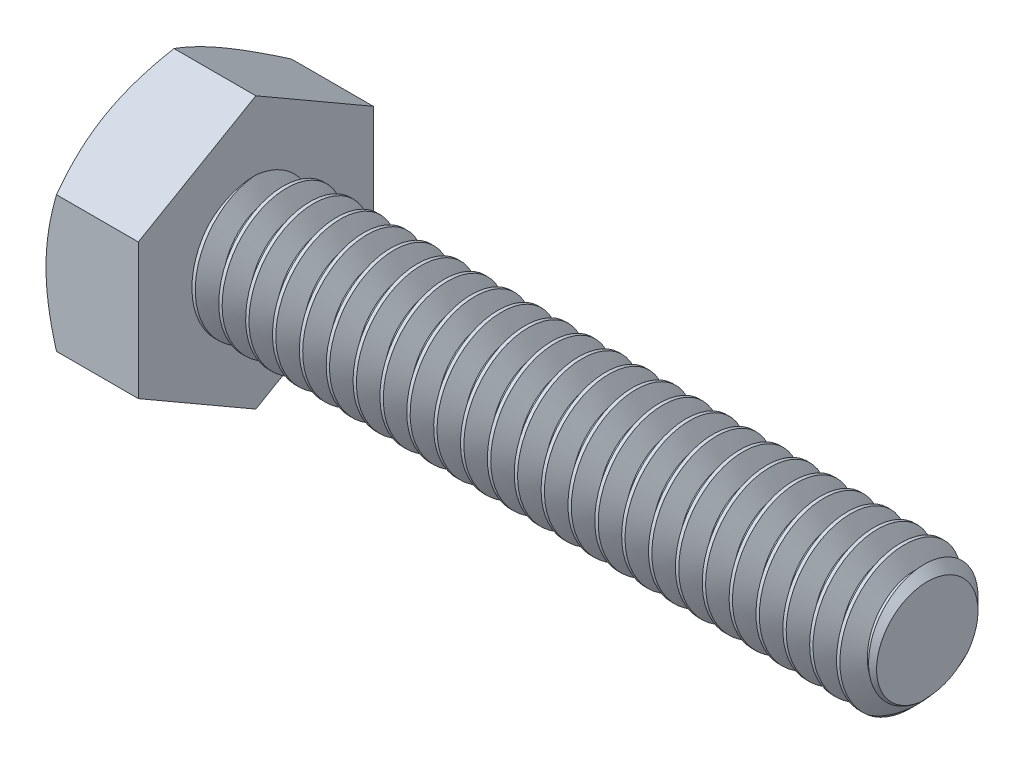
from build123d import *

# Parameters (mm, degrees)
SKETCH5_R           = 3.175
BOSS_EXTRUDE3_DEPTH = 31.75
CHAMFER1_SIZE       = 0.77724
CUT_SWEEP1_PITCH    = 1.27
BOSS_EXTRUDE4_DEPTH = 4.365625
SKETCH8_OUTSIDE_W   = 153.074
SKETCH8_OUTSIDE_H   = 154.794
SKETCH8_OUTSIDE_R   = 5.55625
CUT_EXTRUDE3_DEPTH  = 38.099499254
CUT_EXTRUDE3_DRAFT  = -60
CUT_EXTRUDE4_DEPTH  = 0.254
CIRPATTERN1_COUNT   = 3


with BuildPart() as part:
    # Sketch5 → Boss-Extrude3 (new body)
    with BuildSketch(Plane(origin=(18.0578125, 0, 0), x_dir=(0, 0, -1), z_dir=(1, 0, 0))):
        Circle(SKETCH5_R)
    extrude(amount=-BOSS_EXTRUDE3_DEPTH)

    # Chamfer1
    chamfer1_edges = [part.edges().sort_by_distance(p)[0] for p in [
        (18.0578125, 0, 3.175),
    ]]
    chamfer(chamfer1_edges, length=CHAMFER1_SIZE)

    # Cut-Sweep1: arcs per turn and ends read off the stored shape
    # Cut-Sweep1: the profile of Sketch10 profile screwed along a right-hand helix through 26 turns, 8 arcs to a turn; built about Z, then put on its axis
    cut_sweep1_z = Axis((0, 0, 0), (0, 0, 1))
    cut_sweep1_corners = [(3.1753, 0, 0.000173205), (2.350110803, 0, -0.47625), (2.350110803, 0, -0.635), (3.1753, 0, -1.111423205)]
    with BuildLine(mode=Mode.PRIVATE) as cut_sweep1_profile:
        Line(cut_sweep1_corners[0], cut_sweep1_corners[1])
        Line(cut_sweep1_corners[1], cut_sweep1_corners[2])
        Line(cut_sweep1_corners[2], cut_sweep1_corners[3])
        Line(cut_sweep1_corners[3], cut_sweep1_corners[0])
    cut_sweep1_cap = Face(cut_sweep1_profile.wire())
    cut_sweep1_turn_angles = [0, 22.5, 45, 67.5, 90, 112.5, 135, 157.5, 180, 202.5, 225, 247.5, 270, 292.5, 315, 337.5, 360]
    cut_sweep1_turn_weights = [1, 0.9238795325112867, 1, 0.9238795325112867, 1, 0.9238795325112867, 1, 0.9238795325112867, 1, 0.9238795325112867, 1, 0.9238795325112867, 1, 0.9238795325112867, 1, 0.9238795325112867, 1]
    cut_sweep1_turn_rails = [Edge.make_bspline([Vector(p[0], p[1], 0).rotate(cut_sweep1_z, cut_sweep1_turn_angles[k]) / cut_sweep1_turn_weights[k] + Vector(0, 0, p[2] + CUT_SWEEP1_PITCH * cut_sweep1_turn_angles[k] / 360) for k in range(17)], [0, 0, 0, 1, 1, 2, 2, 3, 3, 4, 4, 5, 5, 6, 6, 7, 7, 8, 8, 8], 2, cut_sweep1_turn_weights) for p in cut_sweep1_corners]
    cut_sweep1_turn_sides = [Face.make_surface_from_curves(cut_sweep1_turn_rails[p[0]], cut_sweep1_turn_rails[p[1]]) for p in [(0, 1), (1, 2), (2, 3), (3, 0)]]
    cut_sweep1 = Plane(origin=(18.0578125, 0, 0), x_dir=(0, 1, 0), z_dir=(-1, 0, 0)) * Solid(Shell([*[p.moved(Location((0, 0, CUT_SWEEP1_PITCH * i))) for i in range(26) for p in cut_sweep1_turn_sides], cut_sweep1_cap, cut_sweep1_cap.rotate(cut_sweep1_z, 9360).moved(Location((0, 0, CUT_SWEEP1_PITCH * 9360 / 360)))]))
    add(cut_sweep1, mode=Mode.SUBTRACT)

    # Sketch6 → Boss-Extrude4 (add)
    with BuildSketch(Plane.ZY.offset(13.6921875)):
        Polygon((5.55625, 3.207902433), (0, 6.415804866), (-5.55625, 3.207902433), (-5.55625, -3.207902433), (0, -6.415804866), (5.55625, -3.207902433), align=None)
    extrude(amount=BOSS_EXTRUDE4_DEPTH)


with BuildPart() as cut_extrude3_tool:
    # Sketch8 outside → Cut-Extrude3 (with draft: the straight prism first)
    with BuildSketch(Plane.ZY.offset(18.0578125)):
        Rectangle(SKETCH8_OUTSIDE_W, SKETCH8_OUTSIDE_H)
        Circle(SKETCH8_OUTSIDE_R, mode=Mode.SUBTRACT)
    extrude(amount=-CUT_EXTRUDE3_DEPTH)
    # Cut-Extrude3: the draft: its side faces are tilted about the plane it starts from
    cut_extrude3_sides = [cut_extrude3_tool.faces().sort_by_distance(p)[0] for p in [
        (0.991937127, -77.397, 0),
        (0.991937127, 0, 76.537),
        (0.991937127, 77.397, 0),
        (0.991937127, 0, -76.537),
        (0.991937127, 0, -5.55625),
    ]]
    draft(cut_extrude3_sides, Plane.ZY.offset(18.0578125), CUT_EXTRUDE3_DRAFT)


with BuildPart() as part_1:
    add(part.part)

    # Cut-Extrude3: cut by cut_extrude3_tool
    add(cut_extrude3_tool.part, mode=Mode.SUBTRACT)

    # Sketch12 → Cut-Extrude4 (cut)
    with BuildSketch(Plane.ZY.offset(18.0578125)):
        with BuildLine():
            Line((0.1666875, 4.2783125), (0.1666875, 2.3891875))
            ThreePointArc((0.1666875, 2.3891875), (0, 2.2225), (-0.1666875, 2.3891875))
            Line((-0.1666875, 2.3891875), (-0.1666875, 4.2783125))
            ThreePointArc((-0.1666875, 4.2783125), (0, 4.445), (0.1666875, 4.2783125))
        make_face()
    cut_extrude4 = extrude(amount=-CUT_EXTRUDE4_DEPTH, mode=Mode.SUBTRACT)

    # CirPattern1: Cut-Extrude4 ×3 about axis
    cirpattern1_axis = Axis((0, 0, 0), (1, 0, 0))
    for i in range(1, CIRPATTERN1_COUNT):
        add(cut_extrude4.rotate(cirpattern1_axis, i * 360 / CIRPATTERN1_COUNT), mode=Mode.SUBTRACT)


solid = part_1.part
